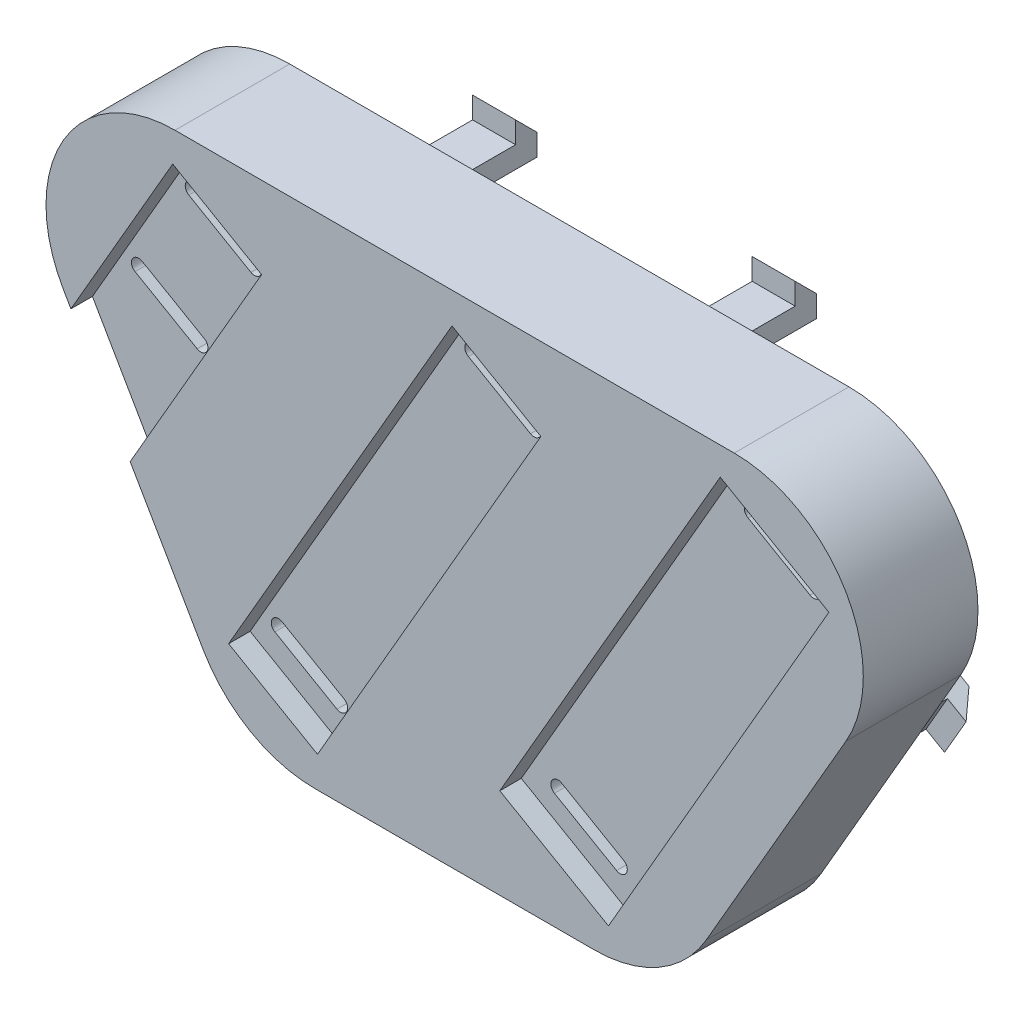
from build123d import *

# Parameters (mm, degrees)
SKETCH1_R           = 7.5
BOSS_EXTRUDE1_DEPTH = 5
BOSS_EXTRUDE2_DEPTH = 1.5
BOSS_EXTRUDE3_DEPTH = 1.5
SKETCH4_W           = 3
SKETCH4_H           = 3
BOSS_EXTRUDE4_DEPTH = 6
CUT_EXTRUDE1_REACH  = 57.939
SKETCH5_W           = 1.5
SKETCH5_H           = 4.5
CUT_EXTRUDE2_REACH  = 50.106
SKETCH7_W           = 4.5
SKETCH7_H           = 1.5
CUT_EXTRUDE3_REACH  = 42.425
SKETCH8_W           = 4.5
SKETCH8_H           = 1.5


with BuildPart() as part:
    # Sketch1 → Boss-Extrude1 (new body)
    with BuildSketch(Plane.XY):
        with BuildLine():
            Line((7.794228634, -4.5), (-1.955771366, -21.387495374))
            ThreePointArc((-1.955771366, -21.387495374), (-5.25, -24.681724008), (-9.75, -25.887495374))
            Line((-9.75, -25.887495374), (-29.25, -25.887495374))
            ThreePointArc((-29.25, -25.887495374), (-33.75, -24.681724008), (-37.044228634, -21.387495374))
            Line((-37.044228634, -21.387495374), (-46.794228634, -4.5))
            ThreePointArc((-46.794228634, -4.5), (-46.794228634, 4.5), (-39, 9))
            Line((-39, 9), (0, 9))
            ThreePointArc((0, 9), (7.794228634, 4.5), (7.794228634, -4.5))
        make_face()
        with Locations((-29.25, -16.887495374)):
            Circle(SKETCH1_R, mode=Mode.SUBTRACT)
        with Locations((-19.5, 0)):
            Circle(SKETCH1_R, mode=Mode.SUBTRACT)
        Circle(SKETCH1_R, mode=Mode.SUBTRACT)
        with Locations((-9.75, -16.887495374)):
            Circle(SKETCH1_R, mode=Mode.SUBTRACT)
        with Locations((-39, 0)):
            Circle(SKETCH1_R, mode=Mode.SUBTRACT)
    extrude(amount=BOSS_EXTRUDE1_DEPTH)

    # Sketch2 → Boss-Extrude2 (add)
    with BuildSketch(Plane.XY.offset(5)):
        with BuildLine():
            ThreePointArc((-9.75, -25.887495374), (-5.25, -24.681724008), (-1.955771366, -21.387495374))
            Line((-1.955771366, -21.387495374), (7.794228634, -4.5))
            ThreePointArc((7.794228634, -4.5), (7.794228634, 4.5), (0, 9))
            Line((0, 9), (-39, 9))
            ThreePointArc((-39, 9), (-46.794228634, 4.5), (-46.794228634, -4.5))
            Line((-46.794228634, -4.5), (-37.044228634, -21.387495374))
            ThreePointArc((-37.044228634, -21.387495374), (-33.75, -24.681724008), (-29.25, -25.887495374))
            Line((-29.25, -25.887495374), (-9.75, -25.887495374))
        make_face()
        with BuildLine():
            Line((-29.209936491, -21.81810334), (-33.540063509, -19.31810334))
            ThreePointArc((-33.540063509, -19.31810334), (-33.723076211, -18.635090638), (-33.040063509, -18.452077936))
            Line((-33.040063509, -18.452077936), (-28.709936491, -20.952077936))
            ThreePointArc((-28.709936491, -20.952077936), (-28.526923789, -21.635090638), (-29.209936491, -21.81810334))
        make_face(mode=Mode.SUBTRACT)
        with BuildLine():
            Line((-9.709936491, -21.81810334), (-14.040063509, -19.31810334))
            ThreePointArc((-14.040063509, -19.31810334), (-14.223076211, -18.635090638), (-13.540063509, -18.452077936))
            Line((-13.540063509, -18.452077936), (-9.209936491, -20.952077936))
            ThreePointArc((-9.209936491, -20.952077936), (-9.026923789, -21.635090638), (-9.709936491, -21.81810334))
        make_face(mode=Mode.SUBTRACT)
        with BuildLine():
            Line((-35.209936491, 1.564582562), (-39.540063509, 4.064582562))
            ThreePointArc((-39.540063509, 4.064582562), (-39.723076211, 4.747595264), (-39.040063509, 4.930607966))
            Line((-39.040063509, 4.930607966), (-34.709936491, 2.430607966))
            ThreePointArc((-34.709936491, 2.430607966), (-34.526923789, 1.747595264), (-35.209936491, 1.564582562))
        make_face(mode=Mode.SUBTRACT)
        with BuildLine():
            ThreePointArc((-38.459936491, -4.064582562), (-38.276923789, -4.747595264), (-38.959936491, -4.930607966))
            Line((-38.959936491, -4.930607966), (-43.290063509, -2.430607966))
            ThreePointArc((-43.290063509, -2.430607966), (-43.473076211, -1.747595264), (-42.790063509, -1.564582562))
            Line((-42.790063509, -1.564582562), (-38.459936491, -4.064582562))
        make_face(mode=Mode.SUBTRACT)
        with BuildLine():
            Line((-15.709936491, 1.564582562), (-20.040063509, 4.064582562))
            ThreePointArc((-20.040063509, 4.064582562), (-20.223076211, 4.747595264), (-19.540063509, 4.930607966))
            Line((-19.540063509, 4.930607966), (-15.209936491, 2.430607966))
            ThreePointArc((-15.209936491, 2.430607966), (-15.026923789, 1.747595264), (-15.709936491, 1.564582562))
        make_face(mode=Mode.SUBTRACT)
        with BuildLine():
            Line((3.790063509, 1.564582562), (-0.540063509, 4.064582562))
            ThreePointArc((-0.540063509, 4.064582562), (-0.723076211, 4.747595264), (-0.040063509, 4.930607966))
            Line((-0.040063509, 4.930607966), (4.290063509, 2.430607966))
            ThreePointArc((4.290063509, 2.430607966), (4.473076211, 1.747595264), (3.790063509, 1.564582562))
        make_face(mode=Mode.SUBTRACT)
    extrude(amount=BOSS_EXTRUDE2_DEPTH)

    # Sketch3 → Boss-Extrude3 (add)
    with BuildSketch(Plane.XY.offset(6.5)):
        with BuildLine():
            ThreePointArc((-39, 9), (-46.794228634, 4.5), (-46.794228634, -4.5))
            Line((-46.794228634, -4.5), (-46.262741693, -5.420562386))
            Line((-46.262741693, -5.420562386), (-39.162383905, 6.877618054))
            Line((-39.162383905, 6.877618054), (-32.962616095, 3.29818044))
            Line((-32.962616095, 3.29818044), (-42.129563153, -12.579437614))
            Line((-42.129563153, -12.579437614), (-37.044228634, -21.387495374))
            ThreePointArc((-37.044228634, -21.387495374), (-33.75, -24.681724008), (-29.25, -25.887495374))
            Line((-29.25, -25.887495374), (-9.75, -25.887495374))
            ThreePointArc((-9.75, -25.887495374), (-5.25, -24.681724008), (-1.955771366, -21.387495374))
            Line((-1.955771366, -21.387495374), (7.794228634, -4.5))
            ThreePointArc((7.794228634, -4.5), (7.794228634, 4.5), (0, 9))
            Line((0, 9), (-39, 9))
        make_face()
        Polygon((-19.685165098, 6.83815987), (-13.485397288, 3.258722256), (-29.064834902, -23.725655244), (-35.264602712, -20.14621763), align=None, mode=Mode.SUBTRACT)
        Polygon((-0.976361142, 7.058892896), (6.601361142, 2.683892896), (-8.773638858, -23.94638827), (-16.351361142, -19.57138827), align=None, mode=Mode.SUBTRACT)
    extrude(amount=BOSS_EXTRUDE3_DEPTH)

    # Sketch4 → Boss-Extrude4 (add)
    with BuildSketch(Plane(origin=(0, 0, 0), x_dir=(-1, 0, 0), z_dir=(0, 0, -1))):
        with Locations((19.5, -24.387495374)):
            Rectangle(SKETCH4_W, SKETCH4_H)
        with Locations((29.25, 7.5)):
            Rectangle(SKETCH4_W, SKETCH4_H)
        with Locations((9.75, 7.5)):
            Rectangle(SKETCH4_W, SKETCH4_H)
        Polygon((41.169228634, -14.242785793), (42.669228634, -11.644709581), (40.071152423, -10.144709581), (38.571152423, -12.742785793), align=None)
        Polygon((-3.669228634, -11.644709581), (-2.169228634, -14.242785793), (0.428847577, -12.742785793), (-1.071152423, -10.144709581), align=None)
    extrude(amount=BOSS_EXTRUDE4_DEPTH)

    # Sketch5 → Cut-Extrude1 (cut, up to next)
    with BuildSketch(Plane(origin=(-5.625, 9.742785793, 0), x_dir=(0.8660254037844386, 0.5000000000000001, 0), z_dir=(-0.5000000000000001, 0.8660254037844386, 0)), mode=Mode.PRIVATE) as cut_extrude1_sk1:
        with Locations((-42.024990748, 2.25)):
            Rectangle(SKETCH5_W, SKETCH5_H)
    cut_extrude1_tool1 = extrude(cut_extrude1_sk1.sketch, amount=-CUT_EXTRUDE1_REACH, mode=Mode.PRIVATE) & part.part
    # Sketch5 → Cut-Extrude1 (cut, up to next)
    with BuildSketch(Plane(origin=(-5.625, 9.742785793, 0), x_dir=(0.8660254037844386, 0.5000000000000001, 0), z_dir=(-0.5000000000000001, 0.8660254037844386, 0)), mode=Mode.PRIVATE) as cut_extrude1_sk2:
        Polygon((-42.774990748, 6), (-42.774990748, 4.5), (-41.274990748, 6), align=None)
    cut_extrude1_tool2 = extrude(cut_extrude1_sk2.sketch, amount=-CUT_EXTRUDE1_REACH, mode=Mode.PRIVATE) & part.part
    cut_extrude1_1 = cut_extrude1_tool1.solids().sort_by_distance((-42.01971, -11.26971, -2.25))[0]
    add(cut_extrude1_1, mode=Mode.SUBTRACT)
    cut_extrude1_2 = cut_extrude1_tool2.solids().sort_by_distance((-42.236216, -11.39471, -5.5))[0]
    add(cut_extrude1_2, mode=Mode.SUBTRACT)
    cut_extrude1 = cut_extrude1_1 + cut_extrude1_2  # Cut-Extrude1 as one shape, for the pattern or mirror that repeats it

    # Sketch7 → Cut-Extrude2 (cut, up to next)
    with BuildSketch(Plane.ZY.offset(30.75), mode=Mode.PRIVATE) as cut_extrude2_sk1:
        with Locations((-2.25, 8.25)):
            Rectangle(SKETCH7_W, SKETCH7_H)
    cut_extrude2_tool1 = extrude(cut_extrude2_sk1.sketch, amount=-CUT_EXTRUDE2_REACH, mode=Mode.PRIVATE) & part.part
    # Sketch7 → Cut-Extrude2 (cut, up to next)
    with BuildSketch(Plane.ZY.offset(30.75), mode=Mode.PRIVATE) as cut_extrude2_sk2:
        Polygon((-6, 7.5), (-4.5, 9), (-6, 9), align=None)
    cut_extrude2_tool2 = extrude(cut_extrude2_sk2.sketch, amount=-CUT_EXTRUDE2_REACH, mode=Mode.PRIVATE) & part.part
    cut_extrude2_1 = cut_extrude2_tool1.solids().sort_by_distance((-30.75, 8.25, -2.25))[0]
    add(cut_extrude2_1, mode=Mode.SUBTRACT)
    cut_extrude2_2 = cut_extrude2_tool2.solids().sort_by_distance((-30.75, 8.5, -5.5))[0]
    add(cut_extrude2_2, mode=Mode.SUBTRACT)
    cut_extrude2 = cut_extrude2_1 + cut_extrude2_2  # Cut-Extrude2 as one shape, for the pattern or mirror that repeats it

    # Mirror1: Cut-Extrude1, Cut-Extrude2 across plane
    add(cut_extrude1.mirror(Plane.ZY.offset(19.5)), mode=Mode.SUBTRACT)
    add(cut_extrude2.mirror(Plane.ZY.offset(19.5)), mode=Mode.SUBTRACT)

    # Sketch8 → Cut-Extrude3 (cut, up to next)
    with BuildSketch(Plane.ZY.offset(21), mode=Mode.PRIVATE) as cut_extrude3_sk1:
        Polygon((-6, -25.887495374), (-4.5, -25.887495374), (-6, -24.387495374), align=None)
    cut_extrude3_tool1 = extrude(cut_extrude3_sk1.sketch, amount=-CUT_EXTRUDE3_REACH, mode=Mode.PRIVATE) & part.part
    # Sketch8 → Cut-Extrude3 (cut, up to next)
    with BuildSketch(Plane.ZY.offset(21), mode=Mode.PRIVATE) as cut_extrude3_sk2:
        with Locations((-2.25, -25.137495374)):
            Rectangle(SKETCH8_W, SKETCH8_H)
    cut_extrude3_tool2 = extrude(cut_extrude3_sk2.sketch, amount=-CUT_EXTRUDE3_REACH, mode=Mode.PRIVATE) & part.part
    add(cut_extrude3_tool1.solids().sort_by_distance((-21, -25.387495, -5.5))[0], mode=Mode.SUBTRACT)
    add(cut_extrude3_tool2.solids().sort_by_distance((-21, -25.137495, -2.25))[0], mode=Mode.SUBTRACT)


solid = part.part
